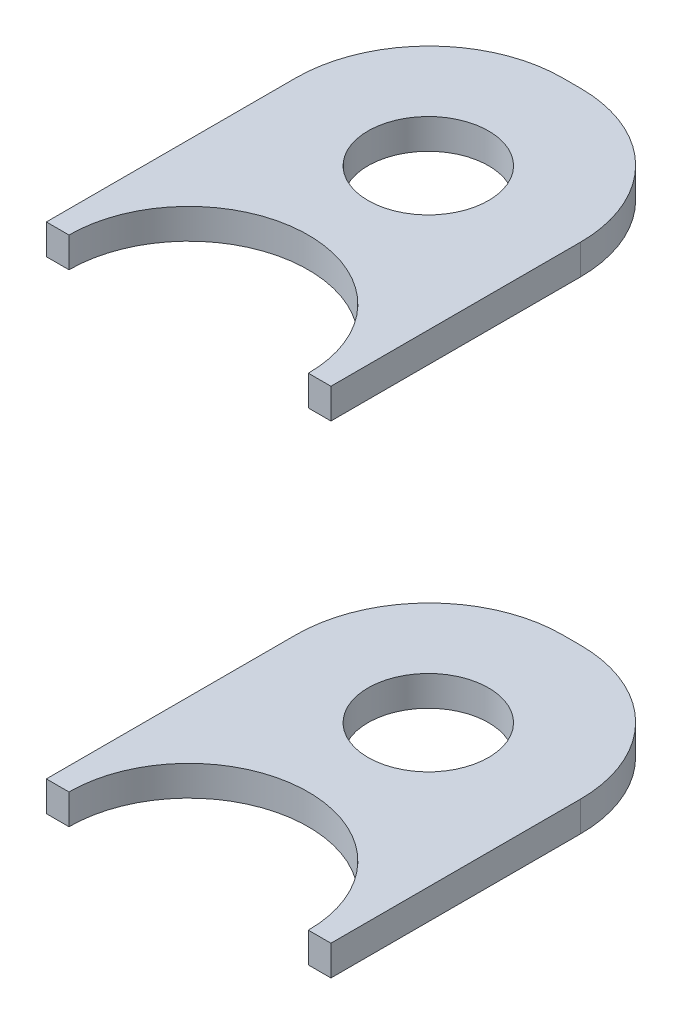
from build123d import *

# Parameters (mm, degrees)
SKETCH1_R           = 8
BOSS_EXTRUDE1_DEPTH = 4


with BuildPart() as part:
    # Sketch1 → Boss-Extrude1 (new body)
    with BuildSketch(Plane(origin=(0, 30, 0), x_dir=(1, 0, 0), z_dir=(0, 1, 0))):
        with BuildLine():
            Line((18.88, -31.8), (15.88, -31.8))
            ThreePointArc((15.88, -31.8), (0, -15.92), (-15.88, -31.8))
            Line((-15.88, -31.8), (-18.88, -31.8))
            Line((-18.88, -31.8), (-18.88, 1.301))
            ThreePointArc((-18.88, 1.301), (-13.69608292, 13.81608292), (-1.181, 19))
            Line((-1.181, 19), (1.181, 19))
            ThreePointArc((1.181, 19), (13.69608292, 13.81608292), (18.88, 1.301))
            Line((18.88, 1.301), (18.88, -31.8))
        make_face()
        Circle(SKETCH1_R, mode=Mode.SUBTRACT)
    extrude(amount=BOSS_EXTRUDE1_DEPTH)


with BuildPart() as body_2:
    # Mirror1: mirrored copy
    add(part.part.mirror(Plane.ZX))


solid = Compound([part.part, body_2.part])
